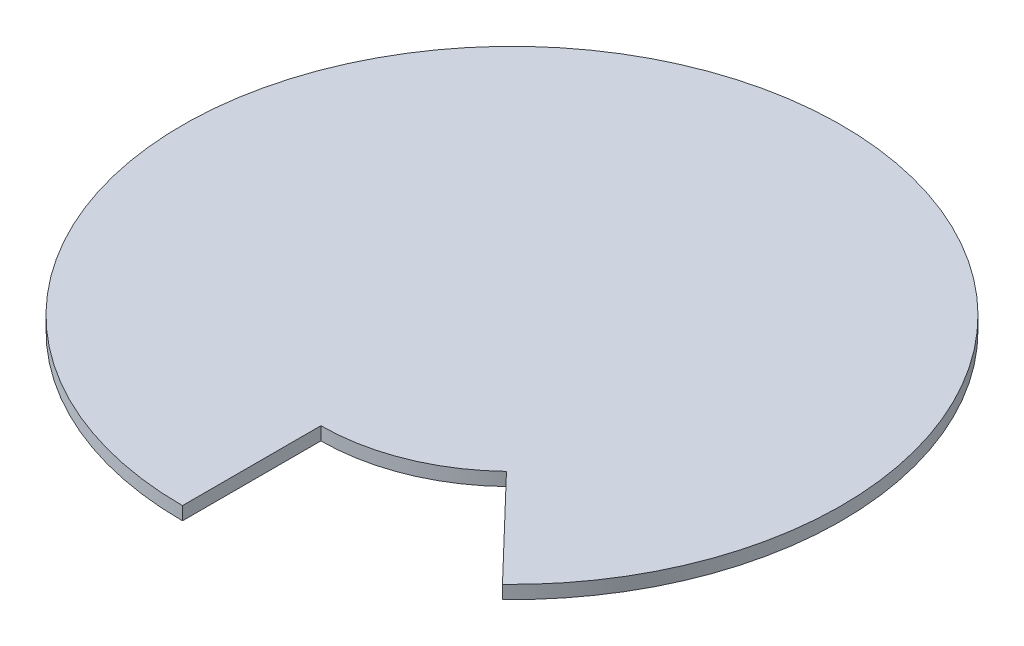
from build123d import *

# Parameters (mm, degrees)
SKETCH1_R           = 100
BOSS_EXTRUDE1_DEPTH = 4
CUT_EXTRUDE1_START  = -10
CUT_EXTRUDE1_DEPTH  = 10


with BuildPart() as part:
    # Sketch1 → Boss-Extrude1 (new body)
    with BuildSketch(Plane(origin=(0, 0, 0), x_dir=(1, 0, 0), z_dir=(0, 1, 0))):
        Circle(SKETCH1_R)
    extrude(amount=BOSS_EXTRUDE1_DEPTH)

    # Sketch3 → Cut-Extrude1 (cut)
    with BuildSketch(Plane(origin=(0, 4, 0), x_dir=(1, 0, 0), z_dir=(0, 1, 0)).offset(CUT_EXTRUDE1_START)):
        with BuildLine():
            Line((0, -100), (0, -58))
            ThreePointArc((0, -58), (21.647379252, -53.8088373), (40.166217521, -41.841067984))
            Line((40.166217521, -41.841067984), (69.252099175, -72.139772386))
            ThreePointArc((69.252099175, -72.139772386), (37.323067675, -92.773857413), (0, -100))
        make_face()
    extrude(amount=CUT_EXTRUDE1_DEPTH, mode=Mode.SUBTRACT)


solid = part.part
